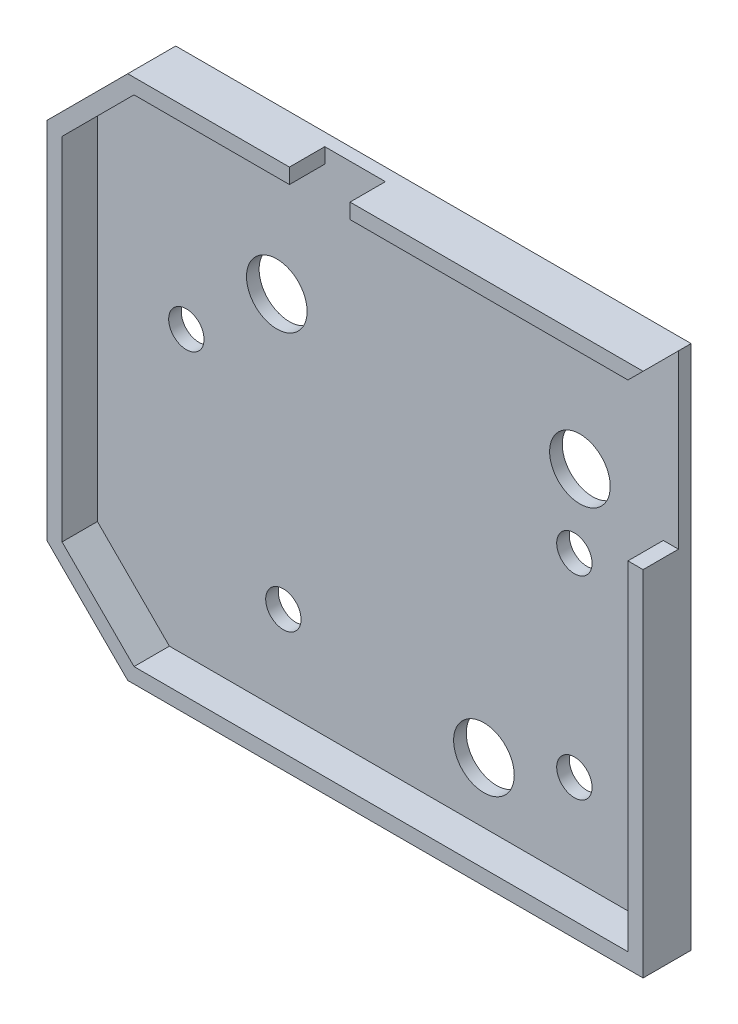
from build123d import *

# Parameters (mm, degrees)
BOSS_EXTRU_1_DEPTH      = 2.5
BOSS_EXTRU_2_DEPTH      = 7
ESQUISSE3_R             = 6
ESQUISSE3_R_2           = 3.5
ENL_V_MAT_EXTRU_1_DEPTH = 10


with BuildPart() as part:
    # Esquisse1 → Boss.-Extru.1 (new body)
    with BuildSketch(Plane.XY):
        Polygon((0, -85), (16, -101), (118, -101), (118, 3), (16, 3), (0, -13), align=None)
    extrude(amount=BOSS_EXTRU_1_DEPTH)

    # Esquisse2 → Boss.-Extru.2 (add)
    with BuildSketch(Plane.XY.offset(2.5)):
        Polygon((115, -31), (118, -31), (118, -101), (16, -101), (0, -85), (0, -13), (16, 3), (48, 3), (48, 0), (17.242640687, 0), (3, -14.242640687), (3, -83.757359313), (17.242640687, -98), (115, -98), align=None)
        Polygon((115, 0), (118, 3), (60, 3), (60, 0), align=None)
    extrude(amount=BOSS_EXTRU_2_DEPTH)

    # Esquisse3 → Enlèv. mat.-Extru.1 (cut)
    with BuildSketch(Plane.XY.offset(2.5)):
        with Locations((98.5, -27)):
            Circle(ESQUISSE3_R)
        with Locations((38.5, -27)):
            Circle(ESQUISSE3_R)
        with Locations((79.5, -86)):
            Circle(ESQUISSE3_R)
        with Locations((97.4, -42)):
            Circle(ESQUISSE3_R_2)
        with Locations((20.6, -42)):
            Circle(ESQUISSE3_R_2)
        with Locations((39.8, -80.4)):
            Circle(ESQUISSE3_R_2)
        with Locations((97.4, -80.4)):
            Circle(ESQUISSE3_R_2)
    extrude(amount=-ENL_V_MAT_EXTRU_1_DEPTH, mode=Mode.SUBTRACT)


solid = part.part
